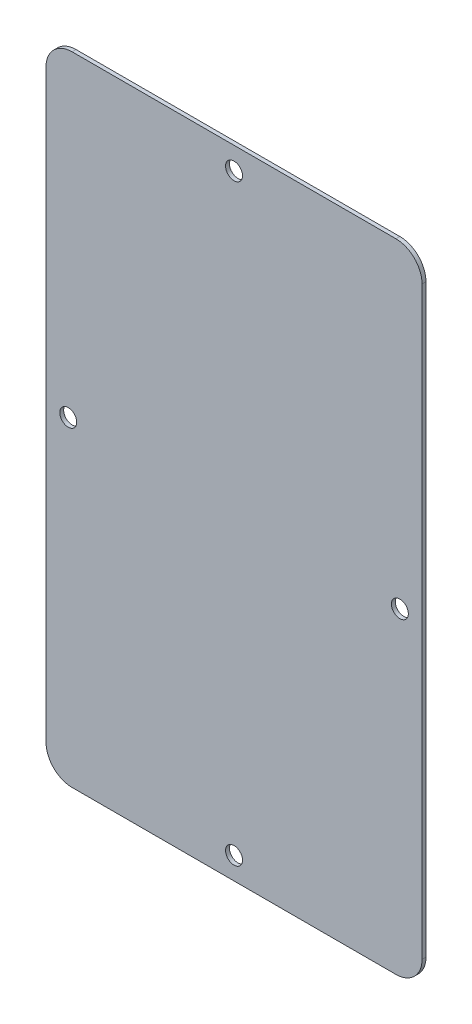
from build123d import *

# Parameters (mm, degrees)
SKETCH1_W          = 144
SKETCH1_H          = 244
BASE_FLANGE1_DEPTH = 1.5
FILLET1_R          = 10
SKETCH6_R          = 3.25
CUT_EXTRUDE1_DEPTH = 10


# Sheet-metal steps are written as plain solids
with BuildPart() as part:
    # Sketch1 → Base-Flange1 (new body)
    with BuildSketch(Plane.XY):
        with Locations((72, 122)):
            Rectangle(SKETCH1_W, SKETCH1_H)
    extrude(amount=-BASE_FLANGE1_DEPTH)

    # Fillet1
    fillet1_edges = [part.edges().sort_by_distance(p)[0] for p in [
        (0, 244, -0.75),
        (144, 244, -0.75),
        (144, 0, -0.75),
        (0, 0, -0.75),
    ]]
    fillet(fillet1_edges, radius=FILLET1_R)

    # Sketch6 → Cut-Extrude1 (cut)
    with BuildSketch(Plane.XY):
        with Locations((72, 235.5)):
            Circle(SKETCH6_R)
        with Locations((72, 8.5)):
            Circle(SKETCH6_R)
        with Locations((8.5, 122)):
            Circle(SKETCH6_R)
        with Locations((135.5, 122)):
            Circle(SKETCH6_R)
    extrude(amount=-CUT_EXTRUDE1_DEPTH, mode=Mode.SUBTRACT)


solid = part.part
